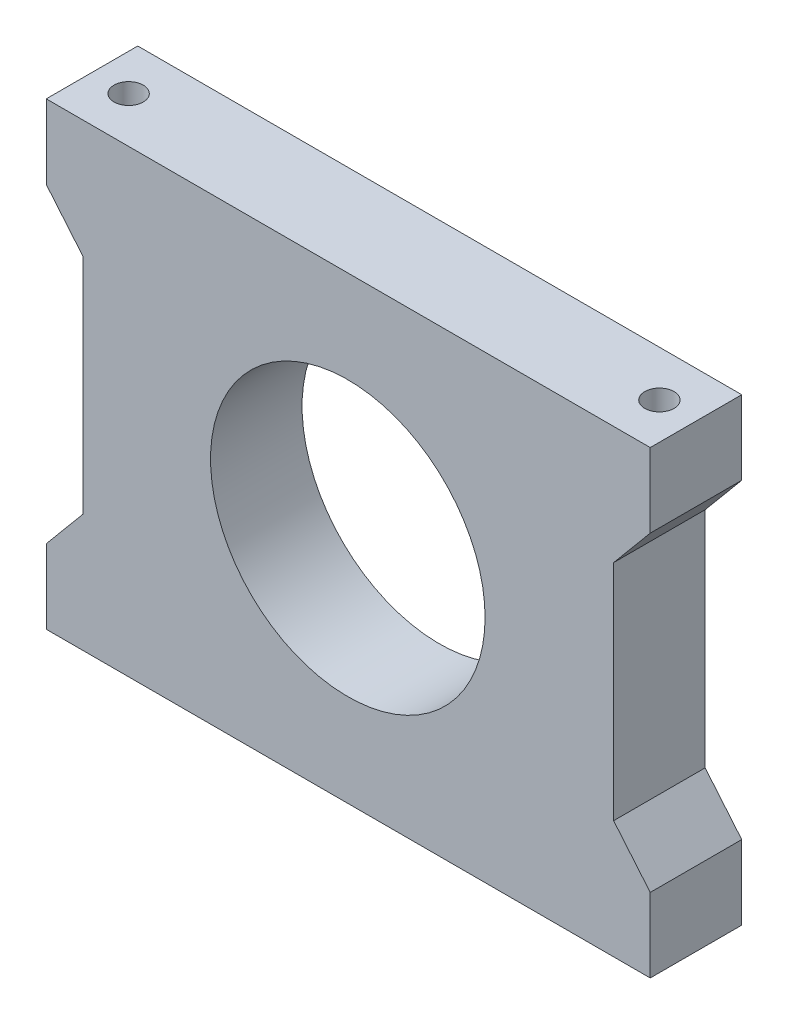
from build123d import *

# Parameters (mm, degrees)
SZKIC1_R                    = 15
DODANIE_WYCI_GNI_CIE1_DEPTH = 10
SZKIC2_R                    = 1.6
WYTNIJ_WYCI_GNI_CIE1_DEPTH  = 10


with BuildPart() as part:
    # Szkic1 → Dodanie-wyciągnięcie1 (new body)
    with BuildSketch(Plane.XY):
        Polygon((0, 0), (66, 0), (66, 8.1), (62, 12.886908539), (62, 37.313091461), (66, 42.1), (66, 50.2), (0, 50.2), (0, 42.1), (4, 37.313091461), (4, 12.886908539), (0, 8.1), align=None)
        with Locations((32.952408039, 25.1)):
            Circle(SZKIC1_R, mode=Mode.SUBTRACT)
    extrude(amount=DODANIE_WYCI_GNI_CIE1_DEPTH)

    # Szkic2 → Wytnij-wyciągnięcie1 (cut)
    with BuildSketch(Plane(origin=(0, 50.2, 0), x_dir=(1, 0, 0), z_dir=(0, 1, 0))):
        with Locations((4, -5)):
            Circle(SZKIC2_R)
        with Locations((62, -5)):
            Circle(SZKIC2_R)
    wytnij_wyci_gni_cie1 = extrude(amount=-WYTNIJ_WYCI_GNI_CIE1_DEPTH, mode=Mode.SUBTRACT)

    # Lustro1: Wytnij-wyciągnięcie1 across plane
    add(wytnij_wyci_gni_cie1.mirror(Plane.ZX.offset(25.1)), mode=Mode.SUBTRACT)


solid = part.part
